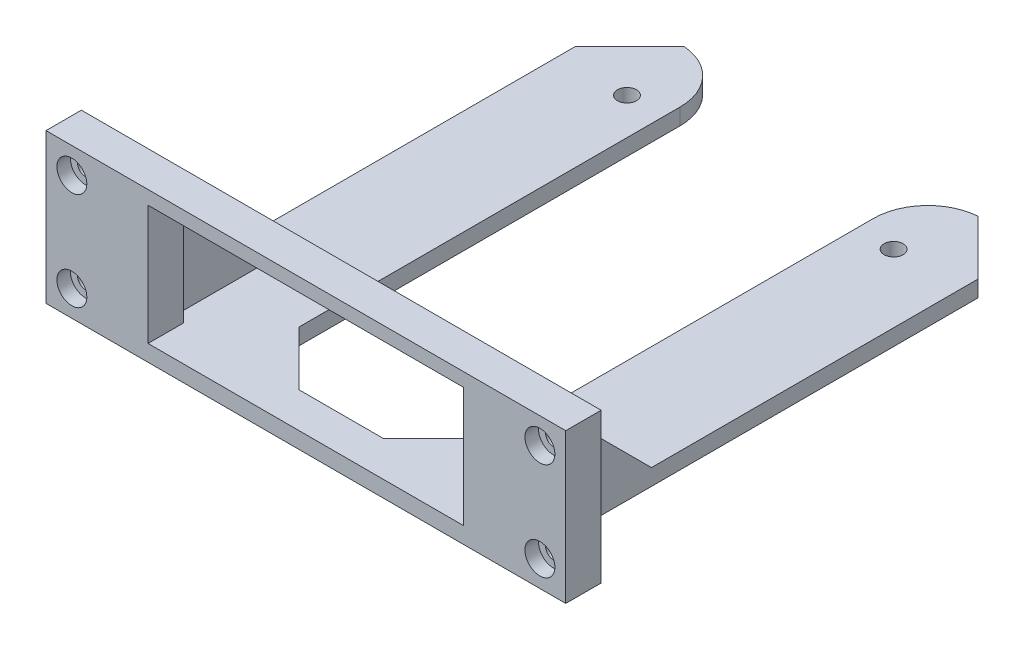
from build123d import *

# Parameters (mm, degrees)
SKETCH1_W                        = 95.5
SKETCH1_H                        = 27.5
BOSS_EXTRUDE1_DEPTH              = 6.5
SKETCH2_W                        = 74
SKETCH2_H                        = 3
BOSS_EXTRUDE2_DEPTH              = 90
SKETCH3_W                        = 58
SKETCH3_H                        = 22
CUT_EXTRUDE1_DEPTH               = 90
CBORE_FOR_M2_5_SHCS1_D           = 2.9
CBORE_FOR_M2_5_SHCS1_DEPTH       = 10.1
CBORE_FOR_M2_5_SHCS1_CBORE_D     = 5.5
CBORE_FOR_M2_5_SHCS1_CBORE_DEPTH = 2.5
CBORE_FOR_M2_5_SHCS1_TIP         = 0.871247898
SKETCH7_W                        = 6
SKETCH7_H                        = 20
BOSS_EXTRUDE3_DEPTH              = 20
CHAMFER1_SIZE                    = 20
F_1_0_3_5_DIAMETER_HOLE1_D       = 3.5
F_1_0_3_5_DIAMETER_HOLE1_DEPTH   = 10.1
F_1_0_3_5_DIAMETER_HOLE1_TIP     = 1.051506083
SKETCH12_W                       = 35.5
SKETCH12_H                       = 90
CUT_EXTRUDE2_DEPTH               = 20
CHAMFER2_SIZE                    = 10
FILLET1_R                        = 10


# Some blends are built 0.0001 mm under size
with BuildPart() as part:
    # Sketch1 → Boss-Extrude1 (new body)
    with BuildSketch(Plane.XY):
        Rectangle(SKETCH1_W, SKETCH1_H)
    extrude(amount=BOSS_EXTRUDE1_DEPTH)

    # Sketch2 → Boss-Extrude2 (add)
    with BuildSketch(Plane(origin=(0, 0, 0), x_dir=(-1, 0, 0), z_dir=(0, 0, -1))):
        with Locations((0, -12.25)):
            Rectangle(SKETCH2_W, SKETCH2_H)
    extrude(amount=BOSS_EXTRUDE2_DEPTH)

    # Sketch3 → Cut-Extrude1 (cut)
    with BuildSketch(Plane(origin=(0, 0, 0), x_dir=(-1, 0, 0), z_dir=(0, 0, -1))):
        with Locations((0, 0.25)):
            Rectangle(SKETCH3_W, SKETCH3_H)
    extrude(amount=-CUT_EXTRUDE1_DEPTH, mode=Mode.SUBTRACT)

    # CBORE for M2.5 SHCS1
    with Locations(Plane.XY.offset(6.5)):
        with Locations((-43, 9), (-43, -9), (43, 9), (43, -9)):
            CounterBoreHole(CBORE_FOR_M2_5_SHCS1_D / 2, CBORE_FOR_M2_5_SHCS1_CBORE_D / 2, CBORE_FOR_M2_5_SHCS1_CBORE_DEPTH, depth=CBORE_FOR_M2_5_SHCS1_DEPTH)
            with Locations((0, 0, -(CBORE_FOR_M2_5_SHCS1_DEPTH + CBORE_FOR_M2_5_SHCS1_TIP / 2))):  # 118° drill point
                Cone(0, CBORE_FOR_M2_5_SHCS1_D / 2, CBORE_FOR_M2_5_SHCS1_TIP, mode=Mode.SUBTRACT)

    # Sketch7 → Boss-Extrude3 (add)
    with BuildSketch(Plane(origin=(0, 0, 0), x_dir=(-1, 0, 0), z_dir=(0, 0, -1))):
        with Locations((-34, -0.75)):
            Rectangle(SKETCH7_W, SKETCH7_H)
        with Locations((34, -0.75)):
            Rectangle(SKETCH7_W, SKETCH7_H)
    extrude(amount=BOSS_EXTRUDE3_DEPTH)

    # Chamfer1
    chamfer1_edges = [part.edges().sort_by_distance(p)[0] for p in [
        (34, 9.25, -20),
        (-34, 9.25, -20),
    ]]
    chamfer(chamfer1_edges, length=CHAMFER1_SIZE - 0.0001)  # a hair under: the kernel refuses the full size

    # Ø1.0 (3.5) Diameter Hole1
    with Locations(Plane(origin=(0, -10.75, 0), x_dir=(1, 0, 0), z_dir=(0, 1, 0))):
        with Locations((-24.5, 77), (24.5, 77), (-24.5, 19), (24.5, 19)):
            Hole(F_1_0_3_5_DIAMETER_HOLE1_D / 2, depth=F_1_0_3_5_DIAMETER_HOLE1_DEPTH)
            with Locations((0, 0, -(F_1_0_3_5_DIAMETER_HOLE1_DEPTH + F_1_0_3_5_DIAMETER_HOLE1_TIP / 2))):  # 118° drill point
                Cone(0, F_1_0_3_5_DIAMETER_HOLE1_D / 2, F_1_0_3_5_DIAMETER_HOLE1_TIP, mode=Mode.SUBTRACT)

    # Sketch12 → Cut-Extrude2 (cut)
    with BuildSketch(Plane(origin=(0, -10.75, 0), x_dir=(1, 0, 0), z_dir=(0, 1, 0))):
        with Locations((0, 45)):
            Rectangle(SKETCH12_W, SKETCH12_H)
    extrude(amount=-CUT_EXTRUDE2_DEPTH, mode=Mode.SUBTRACT)

    # Chamfer2
    chamfer2_edges = [part.edges().sort_by_distance(p)[0] for p in [
        (17.75, -12.25, 0),
        (-17.75, -12.25, 0),
        (37, -12.25, -90),
        (-37, -12.25, -90),
    ]]
    chamfer(chamfer2_edges, length=CHAMFER2_SIZE)

    # Fillet1
    # the kernel refuses this fillet: 10 mm, written as the material it takes off along each edge
    with BuildSketch(Plane(origin=(-17.75, 14.179588344, -90), x_dir=(0, 0, 1), z_dir=(0, -1, 0))) as fillet1_piece_1:
        with BuildLine():
            CenterArc((9.971835338, 10), FILLET1_R, 184.301222305, 85.698777695)
            Line((0, 9.25), (-0.199436707, 9.235))
            ThreePointArc((-0.199436707, 9.235), (-0.2, 4.625), (-0.2, 0))
            Line((-0.2, 0), (0, -0.2))
            Line((0, -0.2), (9.971835338, -0.2))
            Line((9.971835338, -0.2), (9.971835338, 0))
        make_face()
    extrude(amount=52.859176688, mode=Mode.SUBTRACT)
    with BuildSketch(Plane(origin=(17.75, 14.179588344, -90), x_dir=(1, 0, 0), z_dir=(0, -1, 0))) as fillet1_piece_2:
        with BuildLine():
            CenterArc((10, 9.971835338), FILLET1_R, 180, 85.698777695)
            Line((0, 9.971835338), (-0.2, 9.971835338))
            Line((-0.2, 9.971835338), (-0.2, 0))
            Line((-0.2, 0), (0, -0.2))
            ThreePointArc((0, -0.2), (4.625, -0.2), (9.235, -0.199436707))
            Line((9.235, -0.199436707), (9.25, 0))
        make_face()
    extrude(amount=52.859176688, mode=Mode.SUBTRACT)


solid = part.part
